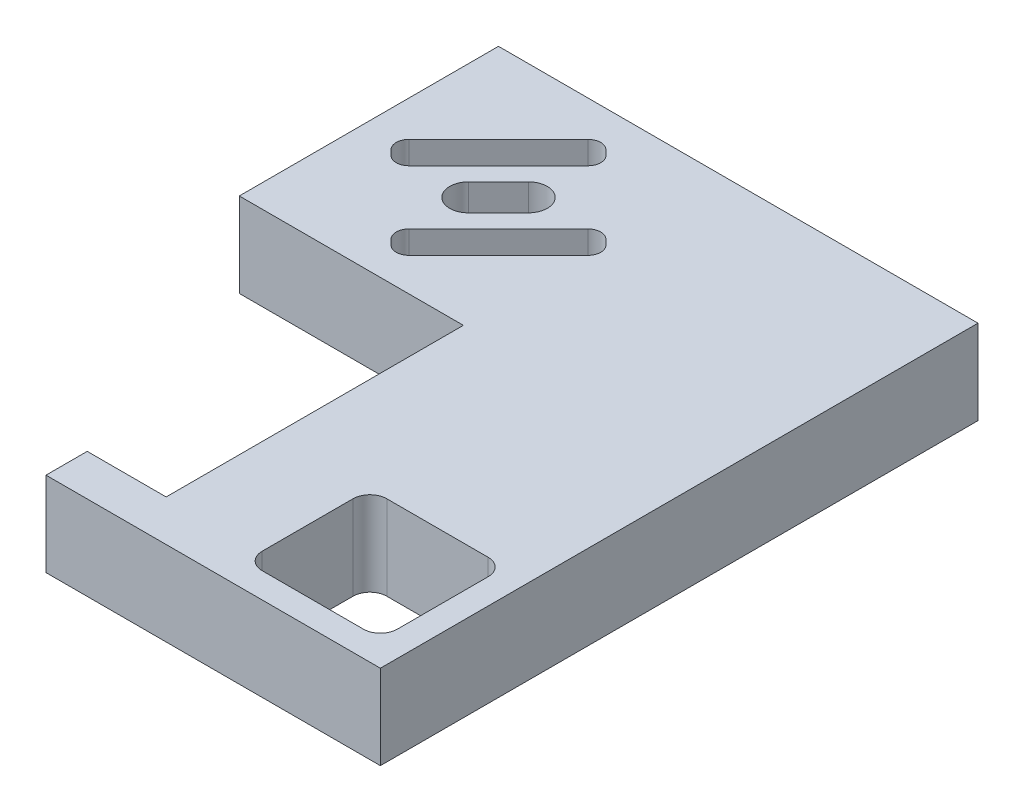
from build123d import *

# Parameters (mm, degrees)
SKETCH3_W                       = 3
SKETCH3_H                       = 10
BOSS_EXTRUDE1_DEPTH             = 15
SKETCH3_W_2                     = 9.160158842
BOSS_EXTRUDE1_2_DEPTH           = 15
BOSS_EXTRUDE1_3_DEPTH           = 15
SKETCH4_W                       = 22.820603272
SKETCH4_H                       = 10
BOSS_EXTRUDE2_DEPTH             = 3
SKETCH5_W                       = 22.820603272
SKETCH5_H                       = 10
BOSS_EXTRUDE3_DEPTH             = 3
SKETCH7_W                       = 16
SKETCH7_H                       = 14.76
BOSS_EXTRUDE4_DEPTH             = 10
SKETCH8_W                       = 6.35
SKETCH8_H                       = 35.2
CUT_EXTRUDE1_DEPTH              = 10
TAP_DRILL_FOR_M3X0_5_TAP1_D     = 2.5
TAP_DRILL_FOR_M3X0_5_TAP1_DEPTH = 10
TAP_DRILL_FOR_M3X0_5_TAP1_TIP   = 0.751075774
BOSS_EXTRUDE5_DEPTH             = 10
CUT_EXTRUDE4_DEPTH              = 319.166667347
CUT_EXTRUDE5_DEPTH              = 5
M4_START                        = -10.356969024
M4_CLEARANCE_SLOT1_DEPTH        = 5
FILLET4_R                       = 2


# Read off the part's stored shape, not the designer's step: M4 Clearance Slot1
with BuildPart() as part:
    # Sketch3 → Boss-Extrude1 (new body)
    with BuildSketch(Plane(origin=(-193.9, 0, 193.9), x_dir=(0.7071067811865475, 0, 0.7071067811865477), z_dir=(-0.7071067811865477, 0, 0.7071067811865475))):
        with Locations((-9.910301636, -10.356969024)):
            Rectangle(SKETCH3_W, SKETCH3_H)
    extrude(amount=-BOSS_EXTRUDE1_DEPTH)



with BuildPart() as body_2:
    # Sketch3 → Boss-Extrude1 2 (new body)
    with BuildSketch(Plane(origin=(-193.9, 0, 193.9), x_dir=(0.7071067811865475, 0, 0.7071067811865477), z_dir=(-0.7071067811865477, 0, 0.7071067811865475))):
        with Locations((0, -10.356969024)):
            Rectangle(SKETCH3_W_2, SKETCH3_H)
    extrude(amount=-BOSS_EXTRUDE1_2_DEPTH)


with BuildPart() as body_3:
    # Sketch3 → Boss-Extrude1 3 (new body)
    with BuildSketch(Plane(origin=(-193.9, 0, 193.9), x_dir=(0.7071067811865475, 0, 0.7071067811865477), z_dir=(-0.7071067811865477, 0, 0.7071067811865475))):
        with Locations((9.910301636, -10.356969024)):
            Rectangle(SKETCH3_W, SKETCH3_H)
    extrude(amount=-BOSS_EXTRUDE1_3_DEPTH)


with BuildPart() as part_1:
    add(part.part)

    add(body_2.part)  # Boss-Extrude2 merges body 2

    add(body_3.part)  # Boss-Extrude2 merges body 3
    # Sketch4 → Boss-Extrude2 (add)
    with BuildSketch(Plane(origin=(-193.9, 0, 193.9), x_dir=(0.7071067811865472, 0, 0.7071067811865479), z_dir=(-0.7071067811865479, 0, 0.7071067811865472))):
        with Locations((0, -10.356969024)):
            Rectangle(SKETCH4_W, SKETCH4_H)
    extrude(amount=BOSS_EXTRUDE2_DEPTH)

    # Sketch5 → Boss-Extrude3 (add)
    with BuildSketch(Plane(origin=(-183.293398282, 0, 183.293398282), x_dir=(-0.7071067811865472, 0, -0.7071067811865479), z_dir=(0.7071067811865479, 0, -0.7071067811865472))):
        with Locations((0, -10.356969024)):
            Rectangle(SKETCH5_W, SKETCH5_H)
    extrude(amount=BOSS_EXTRUDE3_DEPTH)

    # Sketch7 → Boss-Extrude4 (add)
    # profile 1 of 2: a face of its own
    with BuildSketch(Plane(origin=(0, -5.356969024, 0), x_dir=(1, 0, 0), z_dir=(0, 1, 0))):
        Polygon((-204.089622006, -203.8), (-188.242640687, -203.8), (-204.089622006, -187.953018681), align=None)
    # profile 2 of 2: a face of its own
    with BuildSketch(Plane(origin=(0, -5.356969024, 0), x_dir=(1, 0, 0), z_dir=(0, 1, 0))):
        Polygon((-183.9, -239), (-186.9, -239), (-186.9, -243.88), (-147.3, -243.88), (-147.3, -173.103776276), (-189.240379601, -173.103776276), (-173.103776276, -189.240379601), (-187.663396675, -203.8), (-183.9, -203.8), align=None)
        with Locations((-158.3, -233.5)):
            Rectangle(SKETCH7_W, SKETCH7_H, mode=Mode.SUBTRACT)
    extrude(amount=-BOSS_EXTRUDE4_DEPTH)

    # Sketch8 → Cut-Extrude1 (cut)
    with BuildSketch(Plane(origin=(0, -5.356969024, 0), x_dir=(1, 0, 0), z_dir=(0, 1, 0))):
        Polygon((-188.242640687, -203.8), (-187.953018681, -204.089622006), (-187.663396675, -203.8), align=None)
        with Locations((-180.725, -221.4)):
            Rectangle(SKETCH8_W, SKETCH8_H)
    extrude(amount=-CUT_EXTRUDE1_DEPTH, mode=Mode.SUBTRACT)

    # Tap Drill for M3x0.5 Tap1
    with Locations(Plane.ZY.offset(177.55)):
        with Locations((211.9, -10.356969024), (231.9, -10.356969024), (221.9, -10.356969024)):
            Hole(TAP_DRILL_FOR_M3X0_5_TAP1_D / 2, depth=TAP_DRILL_FOR_M3X0_5_TAP1_DEPTH)
            with Locations((0, 0, -(TAP_DRILL_FOR_M3X0_5_TAP1_DEPTH + TAP_DRILL_FOR_M3X0_5_TAP1_TIP / 2))):  # 118° drill point
                Cone(0, TAP_DRILL_FOR_M3X0_5_TAP1_D / 2, TAP_DRILL_FOR_M3X0_5_TAP1_TIP, mode=Mode.SUBTRACT)

    # Sketch13 → Boss-Extrude5 (add)
    with BuildSketch(Plane(origin=(0, -5.356969024, 0), x_dir=(1, 0, 0), z_dir=(0, 1, 0))):
        Polygon((-204.089622006, -173.103776276), (-204.089622006, -187.953018681), (-189.240379601, -173.103776276), align=None)
    extrude(amount=-BOSS_EXTRUDE5_DEPTH)

    # Sketch15 → Cut-Extrude4 (cut, through all)
    with BuildSketch(Plane(origin=(0, -5.356969024, 0), x_dir=(1, 0, 0), z_dir=(0, 1, 0))):
        with BuildLine():
            Line((-186.532003499, -177.933472722), (-187.119059257, -177.346416963))
            ThreePointArc((-187.119059257, -177.346416963), (-188.179719429, -176.907077135), (-189.240379601, -177.346416963))
            Line((-189.240379601, -177.346416963), (-199.846981319, -187.953018681))
            ThreePointArc((-199.846981319, -187.953018681), (-200.286321147, -189.013678853), (-199.846981319, -190.074339025))
            Line((-199.846981319, -190.074339025), (-199.25992556, -190.661394783))
            ThreePointArc((-199.25992556, -190.661394783), (-198.199265388, -191.100734612), (-197.138605217, -190.661394783))
            Line((-197.138605217, -190.661394783), (-186.532003499, -180.054793066))
            ThreePointArc((-186.532003499, -180.054793066), (-186.092663671, -178.994132894), (-186.532003499, -177.933472722))
        make_face()
        with BuildLine():
            Line((-177.346416963, -187.119059257), (-177.933472722, -186.532003499))
            ThreePointArc((-177.933472722, -186.532003499), (-178.994132894, -186.092663671), (-180.054793066, -186.532003499))
            Line((-180.054793066, -186.532003499), (-190.661394783, -197.138605217))
            ThreePointArc((-190.661394783, -197.138605217), (-191.100734612, -198.199265388), (-190.661394783, -199.25992556))
            Line((-190.661394783, -199.25992556), (-190.074339025, -199.846981319))
            ThreePointArc((-190.074339025, -199.846981319), (-189.013678853, -200.286321147), (-187.953018681, -199.846981319))
            Line((-187.953018681, -199.846981319), (-177.346416963, -189.240379601))
            ThreePointArc((-177.346416963, -189.240379601), (-176.907077135, -188.179719429), (-177.346416963, -187.119059257))
        make_face()
    extrude(amount=-CUT_EXTRUDE4_DEPTH, mode=Mode.SUBTRACT)

    # Sketch16 → Cut-Extrude5 (cut)
    with BuildSketch(Plane.XZ.offset(15.356969024)):
        Polygon((-187.119059257, 177.346416963), (-177.346416963, 187.119059257), (-190.074339025, 199.846981319), (-199.846981319, 190.074339025), align=None)
    extrude(amount=-CUT_EXTRUDE5_DEPTH, mode=Mode.SUBTRACT)

    # M4 Clearance Slot1 outline → M4 Clearance Slot1 (cut)
    with BuildSketch(Plane(origin=(0, 0, 0), x_dir=(1, 0, 0), z_dir=(0, 1, 0)).offset(M4_START)):
        with BuildLine():
            Line((-188.419922446, -185.23794193), (-191.955456352, -188.773475836))
            ThreePointArc((-191.955456352, -188.773475836), (-191.955456352, -191.955456352), (-188.773475836, -191.955456352))
            Line((-188.773475836, -191.955456352), (-185.23794193, -188.419922446))
            ThreePointArc((-185.23794193, -188.419922446), (-185.23794193, -185.23794193), (-188.419922446, -185.23794193))
        make_face()
    extrude(amount=M4_CLEARANCE_SLOT1_DEPTH, mode=Mode.SUBTRACT)

    # Fillet4
    fillet4_edges = [part_1.edges().sort_by_distance(p)[0] for p in [
        (-166.3, -10.356969024, 240.88),
        (-166.3, -10.356969024, 226.12),
        (-150.3, -10.356969024, 226.12),
        (-150.3, -10.356969024, 240.88),
    ]]
    fillet(fillet4_edges, radius=FILLET4_R)


solid = part_1.part
